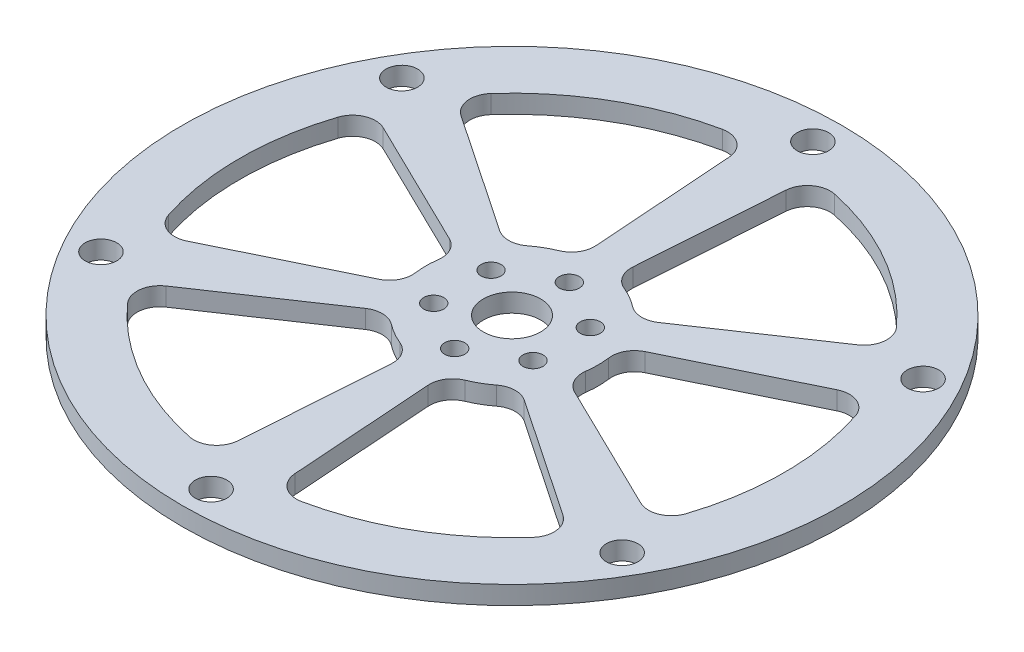
from build123d import *

# Parameters (mm, degrees)
SKETCH1_R                = 15
SKETCH1_R_2              = 5
BOSS_EXTRUDE1_DEPTH      = 3.2
SKETCH2_R                = 57.5
SKETCH2_R_2              = 47.5
BOSS_EXTRUDE2_DEPTH      = 3.2
BOSS_EXTRUDE3_DEPTH      = 3.2
SKETCH3_R                = 1.75
CUT_EXTRUDE2_DEPTH       = 82.380218727
SKETCH4_R                = 2.75
CUT_EXTRUDE3_DEPTH       = 82.380218727
FILLET1_R                = 4
CIRPATTERN1_COUNT        = 6
FILLET1_OF_CIRPATTERN1_R = 4
CIRPATTERN2_COUNT        = 6


with BuildPart() as part:
    # Sketch1 → Boss-Extrude1 (new body)
    with BuildSketch(Plane(origin=(0, 0, 0), x_dir=(1, 0, 0), z_dir=(0, 1, 0))):
        Circle(SKETCH1_R)
        Circle(SKETCH1_R_2, mode=Mode.SUBTRACT)
    extrude(amount=BOSS_EXTRUDE1_DEPTH)



with BuildPart() as body_2:
    # Sketch2 → Boss-Extrude2 (new body)
    with BuildSketch(Plane(origin=(0, 0, 0), x_dir=(1, 0, 0), z_dir=(0, 1, 0))):
        Circle(SKETCH2_R)
        Circle(SKETCH2_R_2, mode=Mode.SUBTRACT)
    extrude(amount=BOSS_EXTRUDE2_DEPTH)


with BuildPart() as part_1:
    add(part.part)

    add(body_2.part)  # Boss-Extrude3 merges body 2
    # Sketch5 → Boss-Extrude3 (add)
    with BuildSketch(Plane(origin=(0, 0, 0), x_dir=(1, 0, 0), z_dir=(0, 1, 0))):
        with BuildLine():
            Line((-5.273281744, 47.20638198), (-3, 14.696938457))
            ThreePointArc((-3, 14.696938457), (0, 15), (3, 14.696938457))
            Line((3, 14.696938457), (5.273281744, 47.20638198))
            ThreePointArc((5.273281744, 47.20638198), (0, 47.5), (-5.273281744, 47.20638198))
        make_face()
    boss_extrude3 = extrude(amount=BOSS_EXTRUDE3_DEPTH)

    # Sketch3 → Cut-Extrude2 (cut, through all)
    with BuildSketch(Plane(origin=(0, 0, 0), x_dir=(1, 0, 0), z_dir=(0, 1, 0))):
        with Locations((0, 10)):
            Circle(SKETCH3_R)
    cut_extrude2 = extrude(amount=CUT_EXTRUDE2_DEPTH, mode=Mode.SUBTRACT)

    # Sketch4 → Cut-Extrude3 (cut, through all)
    with BuildSketch(Plane(origin=(0, 0, 0), x_dir=(1, 0, 0), z_dir=(0, 1, 0))):
        with Locations((0, 52.5)):
            Circle(SKETCH4_R)
    cut_extrude3 = extrude(amount=CUT_EXTRUDE3_DEPTH, mode=Mode.SUBTRACT)

    # Fillet1
    fillet1_edges = [part_1.edges().sort_by_distance(p)[0] for p in [
        (5.273281744, 1.6, -47.20638198),
        (3, 1.6, -14.696938457),
        (-3, 1.6, -14.696938457),
        (-5.273281744, 1.6, -47.20638198),
    ]]
    fillet(fillet1_edges, radius=FILLET1_R)

    # CirPattern1: Boss-Extrude3, Cut-Extrude3 ×6 about axis
    cirpattern1_axis = Axis((0, 3.2, 0), (0, 1, 0))
    add([boss_extrude3.rotate(cirpattern1_axis, i * 360 / CIRPATTERN1_COUNT) for i in range(1, CIRPATTERN1_COUNT)])
    add([cut_extrude3.rotate(cirpattern1_axis, i * 360 / CIRPATTERN1_COUNT) for i in range(1, CIRPATTERN1_COUNT)], mode=Mode.SUBTRACT)

    # Fillet1 of CirPattern1
    fillet1_of_cirpattern1_edges = [part_1.edges().sort_by_distance(p)[0] for p in [
        (-38.245285144, 1.6, -28.169986941),
        (-11.227922061, 1.6, -9.94654544),
        (-14.227922061, 1.6, -4.750393017),
        (-43.518566887, 1.6, -19.036395039),
        (-43.518566887, 1.6, 19.036395039),
        (-14.227922061, 1.6, 4.750393017),
        (-11.227922061, 1.6, 9.94654544),
        (-38.245285144, 1.6, 28.169986941),
        (-5.273281744, 1.6, 47.20638198),
        (-3, 1.6, 14.696938457),
        (3, 1.6, 14.696938457),
        (5.273281744, 1.6, 47.20638198),
        (38.245285144, 1.6, 28.169986941),
        (11.227922061, 1.6, 9.94654544),
        (14.227922061, 1.6, 4.750393017),
        (43.518566887, 1.6, 19.036395039),
        (43.518566887, 1.6, -19.036395039),
        (14.227922061, 1.6, -4.750393017),
        (11.227922061, 1.6, -9.94654544),
        (38.245285144, 1.6, -28.169986941),
    ]]
    fillet(fillet1_of_cirpattern1_edges, radius=FILLET1_OF_CIRPATTERN1_R)

    # CirPattern2: Cut-Extrude2 ×6 about axis
    cirpattern2_axis = Axis((0, 3.2, 0), (0, 1, 0))
    for i in range(1, CIRPATTERN2_COUNT):
        add(cut_extrude2.rotate(cirpattern2_axis, i * 360 / CIRPATTERN2_COUNT), mode=Mode.SUBTRACT)


solid = part_1.part
